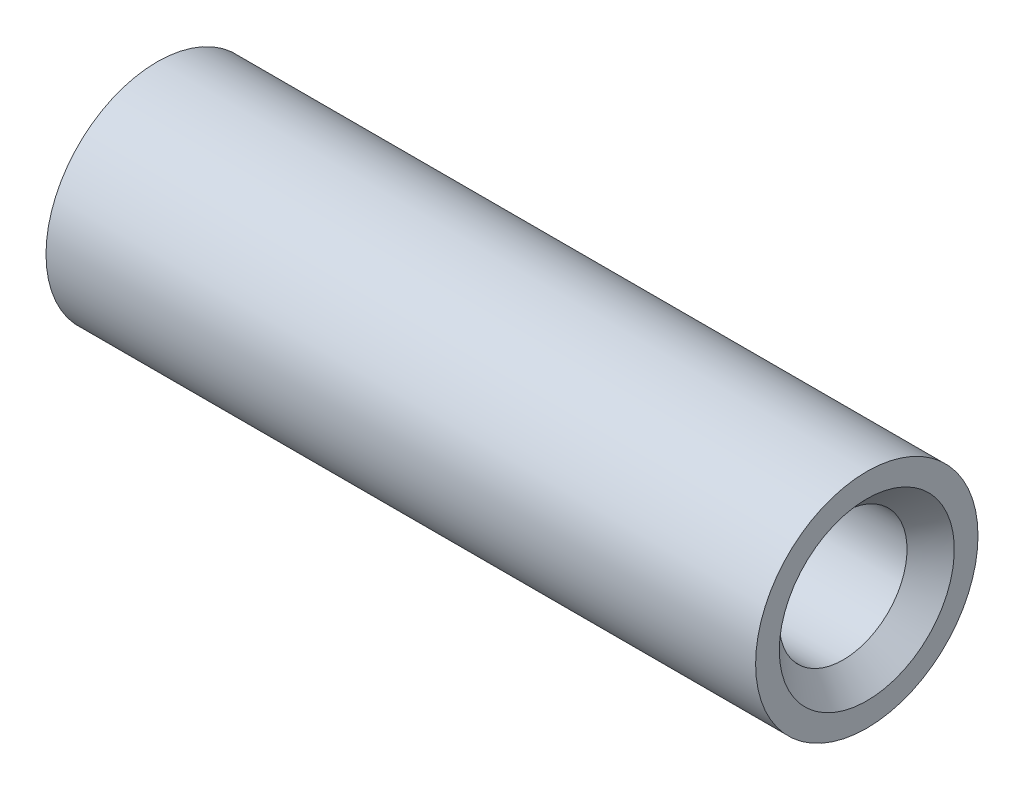
from build123d import *

# Parameters (mm, degrees)
CHAMFER1_SIZE = 1.5


with BuildPart() as part:
    # Sketch1 → Revolve1 (revolve)
    with BuildSketch(Plane.XY):
        Polygon((-2.5, 0), (-2.5, 4.05), (-22.5, 4.05), (-22.5, 7.05143885), (22.5, 7.05143885), (22.5, 4.05), (2.5, 4.05), (2.5, 0), align=None)
    revolve(axis=Axis((0, 0, 0), (1, 0, 0)))

    # Chamfer1
    chamfer1_edges = [part.edges().sort_by_distance(p)[0] for p in [
        (-22.5, -4.05, 0),
        (22.5, -4.05, 0),
    ]]
    chamfer(chamfer1_edges, length=CHAMFER1_SIZE)


solid = part.part
